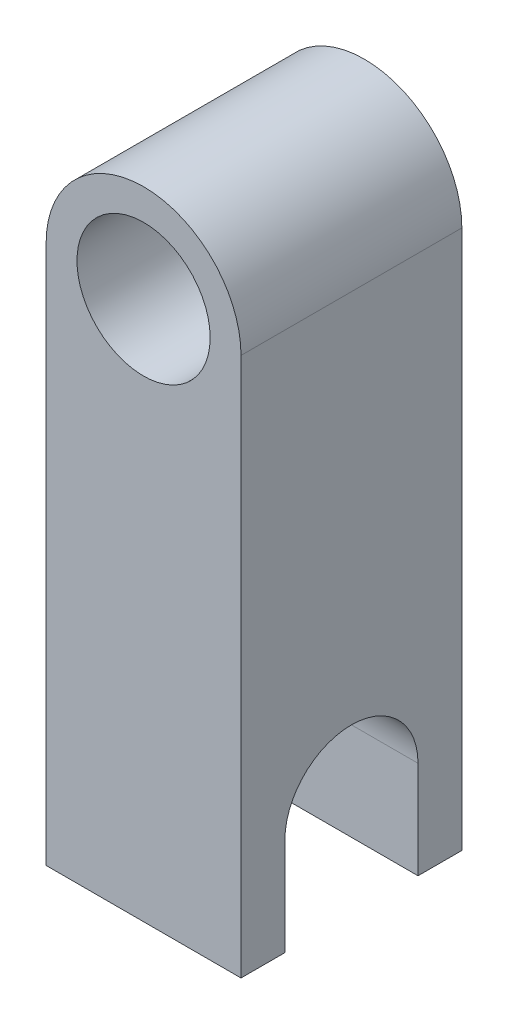
from build123d import *

# Parameters (mm, degrees)
SKETCH1_R           = 10.25
BOSS_EXTRUDE1_DEPTH = 34
SKETCH2_W           = 34
SKETCH2_H           = 15
BOSS_EXTRUDE2_DEPTH = 30
SKETCH3_R           = 10.25
CUT_EXTRUDE1_DEPTH  = 30
SKETCH4_W           = 20.5
SKETCH4_H           = 15
CUT_EXTRUDE2_DEPTH  = 34


with BuildPart() as part:
    # Sketch1 → Boss-Extrude1 (new body)
    with BuildSketch(Plane.XY):
        with BuildLine():
            Line((15, -68), (15, 0))
            ThreePointArc((15, 0), (0, 15), (-15, 0))
            Line((-15, 0), (-15, -68))
            ThreePointArc((-15, -68), (0, -83), (15, -68))
        make_face()
        Circle(SKETCH1_R, mode=Mode.SUBTRACT)
    extrude(amount=BOSS_EXTRUDE1_DEPTH)

    # Sketch2 → Boss-Extrude2 (add)
    with BuildSketch(Plane.ZY.offset(15)):
        with Locations((17, -75.5)):
            Rectangle(SKETCH2_W, SKETCH2_H)
    extrude(amount=-BOSS_EXTRUDE2_DEPTH)

    # Sketch3 → Cut-Extrude1 (cut)
    with BuildSketch(Plane.ZY.offset(15)):
        with Locations((17, -68)):
            Circle(SKETCH3_R)
    extrude(amount=-CUT_EXTRUDE1_DEPTH, mode=Mode.SUBTRACT)

    # Sketch4 → Cut-Extrude2 (cut)
    with BuildSketch(Plane.ZY.offset(15)):
        with Locations((17, -75.5)):
            Rectangle(SKETCH4_W, SKETCH4_H)
    extrude(amount=-CUT_EXTRUDE2_DEPTH, mode=Mode.SUBTRACT)


solid = part.part
